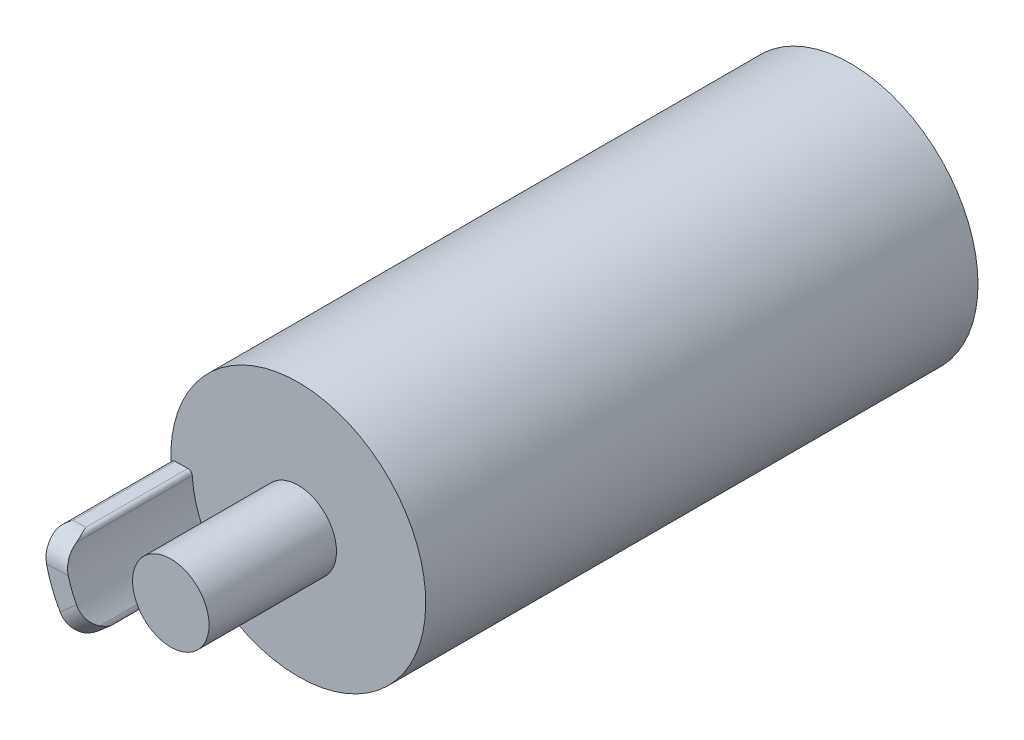
from build123d import *

# Parameters (mm, degrees)
SKETCH_1_R           = 3
SKETCH_1_R_2         = 1.8
EXTRUDE_1_DEPTH      = 13
EXTRUDE_2_DEPTH      = 3
EXTRUDE_2_DEPTH_BACK = 11
SKETCH_2_R           = 0.9
FILLET_1_R           = 0.5
EXTRUDE_START        = -1
SKETCH_3_R           = 3
EXTRUDE_3_DEPTH      = 1
EXTRUDE_4_DEPTH      = 3
FILLET_2_R           = 0.6


with BuildPart() as part:
    # 草图1 → 凸台-拉伸1 (new body)
    with BuildSketch(Plane.XY):
        with Locations(Location((0, 0, 0), (0, 0, 180))):
            Circle(SKETCH_1_R)
        with Locations(Location((0, 0, 0), (0, 0, 180))):
            Circle(SKETCH_1_R_2, mode=Mode.SUBTRACT)
    extrude(amount=EXTRUDE_1_DEPTH)



with BuildPart() as body_2:
    # 草图2 → 凸台-拉伸2 (new, two sides: drawn at the far end of the back side and taken through both)
    with BuildSketch(Plane.XY.offset(13).offset(-EXTRUDE_2_DEPTH_BACK)):
        Circle(SKETCH_2_R)
    extrude(amount=EXTRUDE_2_DEPTH + EXTRUDE_2_DEPTH_BACK)

    # 圆角1
    fillet_1_edges = [body_2.edges().sort_by_distance(p)[0] for p in [
        (-0.9, 0, 2),
    ]]
    fillet(fillet_1_edges, radius=FILLET_1_R)


with BuildPart() as part_1:
    add(part.part)

    add(body_2.part)  # 凸台-拉伸3 merges body 2
    # 草图3 → 凸台-拉伸3 (add)
    with BuildSketch(Plane.XY.offset(13).offset(EXTRUDE_START)):
        with Locations(Location((0, 0, 0), (0, 0, 180))):
            Circle(SKETCH_3_R)
    extrude(amount=EXTRUDE_3_DEPTH)

    # 草图4 → 凸台-拉伸4 (add)
    with BuildSketch(Plane.XY.offset(13)):
        with BuildLine():
            Line((-2.597489972, -0.055189178), (-2.897621372, -0.061566106))
            ThreePointArc((-2.897621372, -0.061566106), (-2.968876341, -0.093606123), (-2.995341868, -0.167114008))
            ThreePointArc((-2.995341868, -0.167114008), (-2.796645847, -1.085712673), (-2.323473449, -1.897754234))
            ThreePointArc((-2.323473449, -1.897754234), (-2.254341449, -1.934149288), (-2.18013282, -1.909717488))
            Line((-2.18013282, -1.909717488), (-1.954317839, -1.711911733))
            ThreePointArc((-1.954317839, -1.711911733), (-1.920572579, -1.645205485), (-1.942508993, -1.573740389))
            ThreePointArc((-1.942508993, -1.573740389), (-2.330538206, -0.904760561), (-2.49554398, -0.149198667))
            ThreePointArc((-2.49554398, -0.149198667), (-2.527574533, -0.081652314), (-2.597489972, -0.055189178))
        make_face()
    extrude(amount=EXTRUDE_4_DEPTH)

    # 圆角2
    # the kernel refuses this fillet: 0.6 mm, written as the material it takes off along each edge
    with BuildSketch(Plane(origin=(-1.097828437, -0.023325691, 16), x_dir=(0, 0, -1), z_dir=(-0.9997743563663354, -0.021242324549825015, 0)), Plane(origin=(-3.308458751, -2.898090189, 16), x_dir=(0, 0, -1), z_dir=(0.7522172870457152, 0.6589151334349395, 0))) as fillet_2_piece_1:
        with BuildLine():
            CenterArc((FILLET_2_R, FILLET_2_R), FILLET_2_R, 180, 90)
            Line((0, FILLET_2_R), (0, 0))
            Line((0, 0), (FILLET_2_R, 0))
        make_face()
    extrude(amount=3.300199138, mode=Mode.SUBTRACT)


solid = part_1.part
